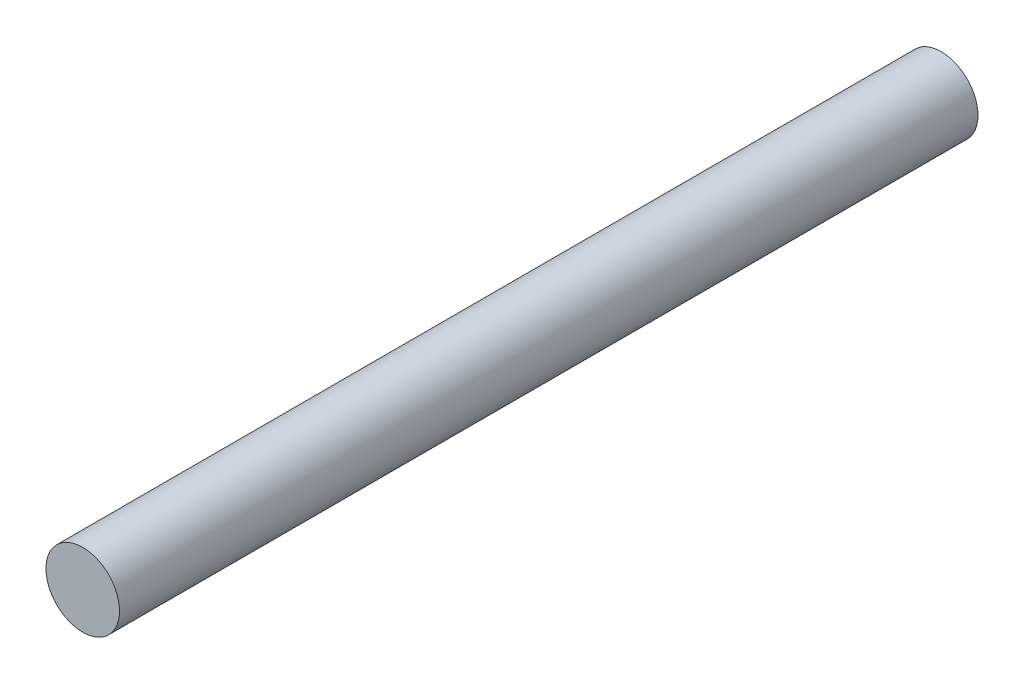
from build123d import *

# Parameters (mm, degrees)
CROQUIS1_R              = 1.5
SALIENTE_EXTRUIR1_DEPTH = 35


with BuildPart() as part:
    # Croquis1 → Saliente-Extruir1 (new body)
    with BuildSketch(Plane.XY):
        Circle(CROQUIS1_R)
    extrude(amount=-SALIENTE_EXTRUIR1_DEPTH)


solid = part.part
